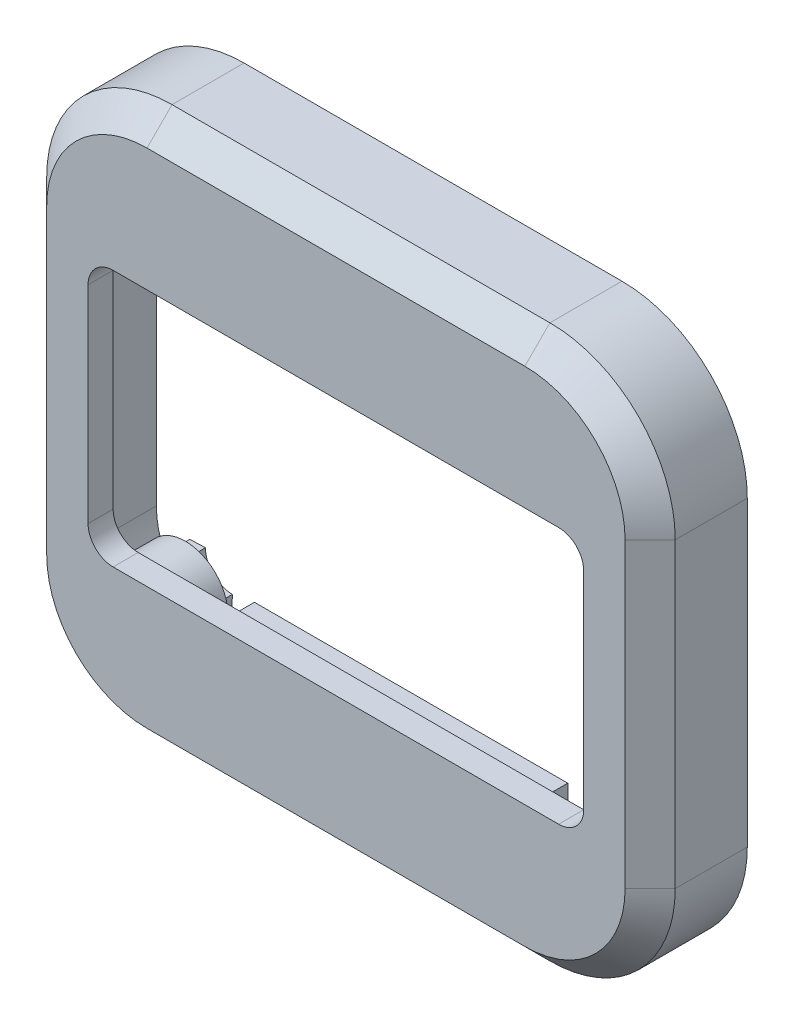
from build123d import *

# Parameters (mm, degrees)
SKETCH1_W                = 39.55
SKETCH1_H                = 20.5
BOSS_EXTRUDE1_DEPTH      = 2
BOSS_EXTRUDE2_DEPTH      = 5.75
SKETCH3_W                = 25
SKETCH3_H                = 6
BOSS_EXTRUDE3_DEPTH      = 4
FILLET1_R                = 2
CHAMFER1_SIZE            = 2
CHAMFER2_SIZE            = 2
SKETCH4_R                = 3.4
SKETCH4_R_2              = 1.4
BOSS_EXTRUDE4_DEPTH      = 4
CHAMFER3_SIZE            = 0.75
CHAMFER3_OF_MIRROR1_SIZE = 0.75
BOSS_EXTRUDE6_DEPTH      = 3.75
MIRROR4_COPY_1_DEPTH     = 3.75


# Read off the part's stored shape, not the designer's step: Mirror2
with BuildPart() as part:
    # Sketch1 → Boss-Extrude1 (new body)
    with BuildSketch(Plane.XY.offset(57.451538964)):
        with BuildLine():
            Line((-141.643342382, 29.433342856), (-141.643342382, 5.333342856))
            ThreePointArc((-141.643342382, 5.333342856), (-138.714410194, -1.737724956), (-131.643342382, -4.666657144))
            Line((-131.643342382, -4.666657144), (-101.493342382, -4.666657144))
            ThreePointArc((-101.493342382, -4.666657144), (-94.42227457, -1.737724956), (-91.493342382, 5.333342856))
            Line((-91.493342382, 5.333342856), (-91.493342382, 29.433342856))
            ThreePointArc((-91.493342382, 29.433342856), (-94.42227457, 36.504410668), (-101.493342382, 39.433342856))
            Line((-101.493342382, 39.433342856), (-131.643342382, 39.433342856))
            ThreePointArc((-131.643342382, 39.433342856), (-138.714410194, 36.504410668), (-141.643342382, 29.433342856))
        make_face()
        with Locations((-116.568342382, 17.383342856)):
            Rectangle(SKETCH1_W, SKETCH1_H, mode=Mode.SUBTRACT)
    extrude(amount=-BOSS_EXTRUDE1_DEPTH)

    # Sketch2 → Boss-Extrude2 (add)
    with BuildSketch(Plane(origin=(0, 0, 55.451538964), x_dir=(-1, 0, 0), z_dir=(0, 0, -1))):
        with BuildLine():
            Line((141.643342382, 5.333342856), (141.643342382, 29.433342856))
            ThreePointArc((141.643342382, 29.433342856), (138.714410194, 36.504410668), (131.643342382, 39.433342856))
            Line((131.643342382, 39.433342856), (101.493342382, 39.433342856))
            ThreePointArc((101.493342382, 39.433342856), (94.42227457, 36.504410668), (91.493342382, 29.433342856))
            Line((91.493342382, 29.433342856), (91.493342382, 5.333342856))
            ThreePointArc((91.493342382, 5.333342856), (94.42227457, -1.737724956), (101.493342382, -4.666657144))
            Line((101.493342382, -4.666657144), (131.643342382, -4.666657144))
            ThreePointArc((131.643342382, -4.666657144), (138.714410194, -1.737724956), (141.643342382, 5.333342856))
        make_face()
        with BuildLine():
            Line((138.643342382, 5.333342856), (138.643342382, 29.433342856))
            ThreePointArc((138.643342382, 29.433342856), (136.59308985, 34.383090325), (131.643342382, 36.433342856))
            Line((131.643342382, 36.433342856), (101.493342382, 36.433342856))
            ThreePointArc((101.493342382, 36.433342856), (96.543594913, 34.383090325), (94.493342382, 29.433342856))
            Line((94.493342382, 29.433342856), (94.493342382, 5.333342856))
            ThreePointArc((94.493342382, 5.333342856), (96.543594913, 0.383595388), (101.493342382, -1.666657144))
            Line((101.493342382, -1.666657144), (131.643342382, -1.666657144))
            ThreePointArc((131.643342382, -1.666657144), (136.59308985, 0.383595388), (138.643342382, 5.333342856))
        make_face(mode=Mode.SUBTRACT)
    extrude(amount=BOSS_EXTRUDE2_DEPTH)

    # Sketch3 → Boss-Extrude3 (add)
    with BuildSketch(Plane(origin=(0, 0, 55.451538964), x_dir=(-1, 0, 0), z_dir=(0, 0, -1))):
        with Locations((116.568342382, 33.433342856)):
            Rectangle(SKETCH3_W, SKETCH3_H)
        with Locations((116.568342382, 1.333342856)):
            Rectangle(SKETCH3_W, SKETCH3_H)
    extrude(amount=BOSS_EXTRUDE3_DEPTH)

    # Fillet1
    fillet1_edges = [part.edges().sort_by_distance(p)[0] for p in [
        (-136.343342382, 27.633342856, 56.451538964),
        (-136.343342382, 7.133342856, 56.451538964),
        (-96.793342382, 7.133342856, 56.451538964),
        (-96.793342382, 27.633342856, 56.451538964),
    ]]
    fillet(fillet1_edges, radius=FILLET1_R)

    # Chamfer1
    chamfer1_edges = [part.edges().sort_by_distance(p)[0] for p in [
        (-138.714410194, 36.504410668, 57.451538964),
        (-116.568342382, 39.433342856, 57.451538964),
        (-94.42227457, 36.504410668, 57.451538964),
        (-91.493342382, 17.383342856, 57.451538964),
        (-94.42227457, -1.737724956, 57.451538964),
        (-116.568342382, -4.666657144, 57.451538964),
        (-138.714410194, -1.737724956, 57.451538964),
        (-141.643342382, 17.383342856, 57.451538964),
    ]]
    chamfer(chamfer1_edges, length=CHAMFER1_SIZE)

    # Chamfer2
    chamfer2_edges = [part.edges().sort_by_distance(p)[0] for p in [
        (-136.59308985, 0.383595388, 55.451538964),
        (-138.643342382, 17.383342856, 55.451538964),
        (-136.59308985, 34.383090325, 55.451538964),
        (-130.355842382, 36.433342856, 55.451538964),
        (-96.543594913, 34.383090325, 55.451538964),
        (-94.493342382, 17.383342856, 55.451538964),
        (-96.543594913, 0.383595388, 55.451538964),
        (-102.780842382, -1.666657144, 55.451538964),
        (-102.780842382, 36.433342856, 55.451538964),
        (-130.355842382, -1.666657144, 55.451538964),
    ]]
    chamfer(chamfer2_edges, length=CHAMFER2_SIZE)

    # Sketch4 → Boss-Extrude4 (add)
    with BuildSketch(Plane(origin=(0, 0, 55.451538964), x_dir=(-1, 0, 0), z_dir=(0, 0, -1))):
        with Locations((134.577835524, 32.367835998)):
            Circle(SKETCH4_R)
        with Locations(Location((134.577835524, 32.367835998, 0), (0, 0, 104.95728905))):
            Circle(SKETCH4_R_2, mode=Mode.SUBTRACT)
    boss_extrude4 = extrude(amount=BOSS_EXTRUDE4_DEPTH)

    # Chamfer3
    chamfer3_edges = [part.edges().sort_by_distance(p)[0] for p in [
        (-134.939174021, 31.015270107, 51.451538964),
    ]]
    chamfer(chamfer3_edges, length=CHAMFER3_SIZE)

    # Mirror1: Boss-Extrude4 across plane
    add(boss_extrude4.mirror(Plane(origin=(-116.568342382, 0, 0), x_dir=(0, 0, 1), z_dir=(1, 0, 0))))

    # Chamfer3 of Mirror1
    chamfer3_of_mirror1_edges = [part.edges().sort_by_distance(p)[0] for p in [
        (-98.197510742, 31.015270107, 51.451538964),
    ]]
    chamfer(chamfer3_of_mirror1_edges, length=CHAMFER3_OF_MIRROR1_SIZE)

    # Mirror2 outline → Mirror2 (revolve)
    with BuildSketch(Plane(origin=(-98.55884924, 2.398849714, 0), x_dir=(1, 0, 0), z_dir=(0, -1, 0))):
        Polygon((1.4, 52.201538964), (2.15, 51.451538964), (3.4, 51.451538964), (3.4, 55.451538967), (1.4, 55.451538967), align=None)
    revolve(axis=Axis((-98.55884924, 2.398849714, 0), (0, 0, 1)))

    # Mirror2 2 outline → Mirror2 2 (revolve)
    with BuildSketch(Plane(origin=(-134.577835524, 2.398849714, 0), x_dir=(1, 0, 0), z_dir=(0, -1, 0))):
        Polygon((1.4, 52.201538964), (2.15, 51.451538964), (3.4, 51.451538964), (3.4, 55.451538967), (1.4, 55.451538967), align=None)
    revolve(axis=Axis((-134.577835524, 2.398849714, 0), (0, 0, 1)))

    # Sketch5 → Boss-Extrude6 (add)
    with BuildSketch(Plane(origin=(0, 0, 51.451538964), x_dir=(-1, 0, 0), z_dir=(0, 0, -1))):
        with BuildLine():
            Line((98.55884924, 34.517835998), (98.513747348, 35.767536841))
            ThreePointArc((98.513747348, 35.767536841), (96.543594913, 34.383090325), (95.159148397, 32.41293789))
            Line((95.159148397, 32.41293789), (96.40884924, 32.367835998))
            ThreePointArc((96.40884924, 32.367835998), (97.03856966, 33.888115578), (98.55884924, 34.517835998))
        make_face()
    boss_extrude6 = extrude(amount=BOSS_EXTRUDE6_DEPTH)

    # Mirror3: Boss-Extrude6 across plane
    add(boss_extrude6.mirror(Plane(origin=(-116.568342382, 0, 0), x_dir=(0, 0, 1), z_dir=(1, 0, 0))))

    # Mirror4: Boss-Extrude6 across plane
    add(boss_extrude6.mirror(Plane.ZX.offset(17.383342856)))

    # Mirror4 copy 1 sketch → Mirror4 copy 1 (add)
    with BuildSketch(Plane(origin=(-233.136684763, 34.766685713, 51.451538964), x_dir=(1, 0, 0), z_dir=(0, 0, -1))):
        with BuildLine():
            Line((98.55884924, 34.517835998), (98.513747348, 35.767536841))
            ThreePointArc((98.513747348, 35.767536841), (96.543594913, 34.383090325), (95.159148397, 32.41293789))
            Line((95.159148397, 32.41293789), (96.40884924, 32.367835998))
            ThreePointArc((96.40884924, 32.367835998), (97.03856966, 33.888115578), (98.55884924, 34.517835998))
        make_face()
    extrude(amount=MIRROR4_COPY_1_DEPTH)


solid = part.part
